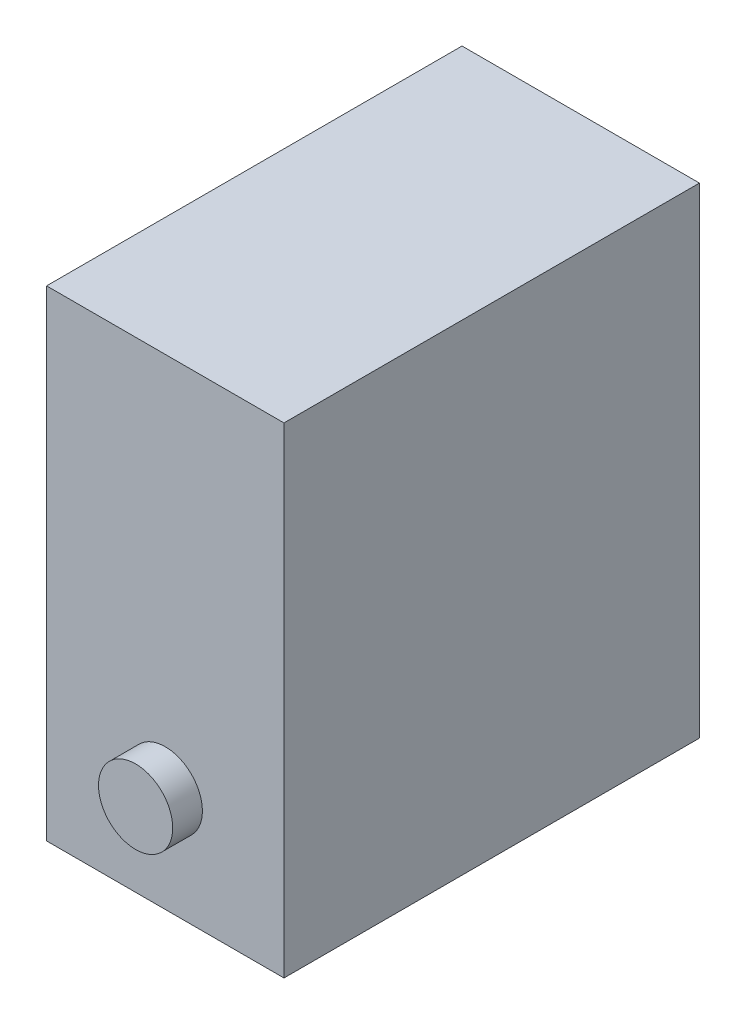
from build123d import *

# Parameters (mm, degrees)
SKETCH1_W           = 20.32
SKETCH1_H           = 35.56
BOSS_EXTRUDE1_DEPTH = 41.148
SKETCH2_R           = 3.175
BOSS_EXTRUDE2_DEPTH = 2.54


with BuildPart() as part:
    # Sketch1 → Boss-Extrude1 (new body)
    with BuildSketch(Plane(origin=(0, 0, 0), x_dir=(1, 0, 0), z_dir=(0, 1, 0))):
        with Locations((10.16, 17.78)):
            Rectangle(SKETCH1_W, SKETCH1_H)
    extrude(amount=BOSS_EXTRUDE1_DEPTH)

    # Sketch2 → Boss-Extrude2 (add)
    with BuildSketch(Plane.XY):
        with Locations((10.16, 8.89)):
            Circle(SKETCH2_R)
    extrude(amount=BOSS_EXTRUDE2_DEPTH)


solid = part.part
